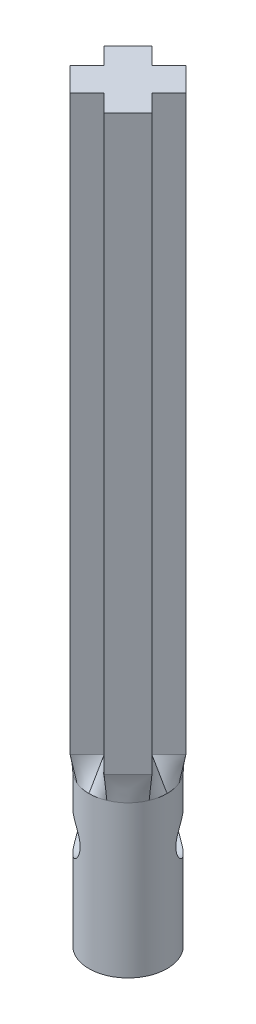
from build123d import *

# Parameters (mm, degrees)
BOSS_EXTRUDE1_DEPTH = 60.739130435
SCALE1_SCALE        = 0.92
SKETCH4_R           = 3.81
SKETCH3_R           = 3.81
BOSS_EXTRUDE2_DEPTH = 14.7955
SKETCH5_R           = 1.905
CUT_EXTRUDE1_DEPTH  = 60.074868333


with BuildPart() as part:
    # Sketch1 → Boss-Extrude1 (new body)
    with BuildSketch(Plane(origin=(0, 0, 0), x_dir=(1, 0, 0), z_dir=(0, 1, 0))):
        Polygon((-0.6269783, 2.91618698), (-2.423029524, 4.712238204), (-4.963029524, 2.172238204), (-3.1669783, 0.37618698), (-4.963029524, -1.419864244), (-2.423029524, -3.959864244), (-0.6269783, -2.16381302), (1.169072924, -3.959864244), (3.709072924, -1.419864244), (1.9130217, 0.37618698), (3.709072924, 2.172238204), (1.169072924, 4.712238204), align=None)
    extrude(amount=BOSS_EXTRUDE1_DEPTH)


with BuildPart() as part_1:
    # Scale1: scaled about (-0.6269783, 30.369565217, -0.37618698)
    add(part.part.scale(SCALE1_SCALE).moved(Location((-0.050158264, 2.429565217, -0.030094958))))

    # Sketch4 → section 1 of loft1
    with BuildSketch(Plane(origin=(0, -0.110434783, 0), x_dir=(-1, 0, 0), z_dir=(0, -1, 0)), mode=Mode.PRIVATE) as loft1_s1:
        with Locations((0.6269783, 0.37618698)):
            Circle(SKETCH4_R)
    # loft from a face of the part (loft1)
    loft([part_1.faces().sort_by_distance((-0.6269783, 2.429565217, -0.37618698))[0], loft1_s1.sketch])

    # Sketch3 → Boss-Extrude2 (add)
    with BuildSketch(Plane(origin=(0, -0.110434783, 0), x_dir=(1, 0, 0), z_dir=(0, 1, 0))):
        with Locations((-0.6269783, 0.37618698)):
            Circle(SKETCH3_R)
    extrude(amount=-BOSS_EXTRUDE2_DEPTH)

    # Sketch5 → Cut-Extrude1 (cut, through all)
    with BuildSketch(Plane(origin=(2.568681176, 0, -2.568681176), x_dir=(-0.7071067811865475, 0, -0.7071067811865476), z_dir=(0.7071067811865476, 0, -0.7071067811865475))):
        with Locations((0.709344972, -5.190434783)):
            Circle(SKETCH5_R)
    extrude(amount=-CUT_EXTRUDE1_DEPTH, mode=Mode.SUBTRACT)


solid = part_1.part
